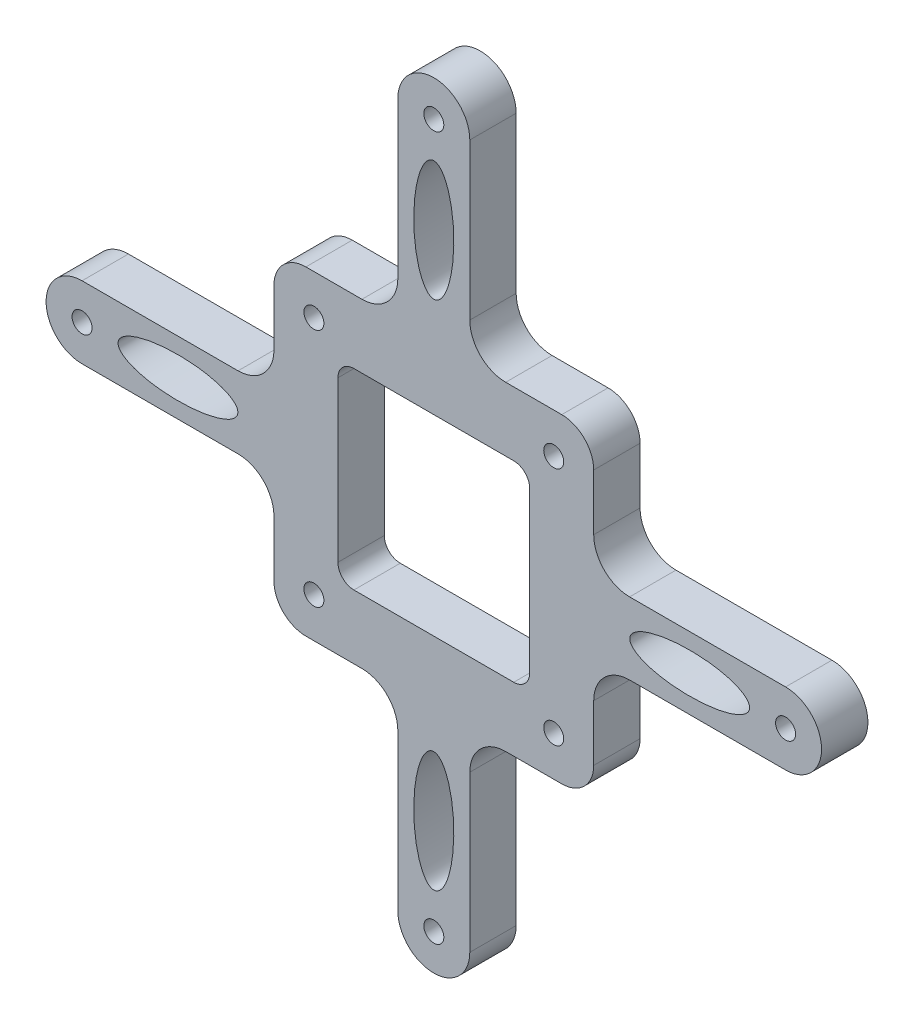
from build123d import *

# Parameters (mm, degrees)
SKETCH1_R           = 1.25
SKETCH1_RX          = 7.495001668
SKETCH1_RY          = 2.505000234
BOSS_EXTRUDE1_DEPTH = 5.8


with BuildPart() as part:
    # Sketch1 → Boss-Extrude1 (new body)
    with BuildSketch(Plane.XY):
        with BuildLine():
            Line((-16, 20), (-8.99, 20))
            ThreePointArc((-8.99, 20), (-5.815090552, 21.315090552), (-4.5, 24.49))
            Line((-4.5, 24.49), (-4.5, 44))
            ThreePointArc((-4.5, 44), (-3.181980515, 47.181980515), (0, 48.5))
            ThreePointArc((0, 48.5), (3.181980515, 47.181980515), (4.5, 44))
            Line((4.5, 44), (4.5, 24.49))
            ThreePointArc((4.5, 24.49), (5.815090552, 21.315090552), (8.99, 20))
            Line((8.99, 20), (16, 20))
            ThreePointArc((16, 20), (18.828427125, 18.828427125), (20, 16))
            Line((20, 16), (20, 8.99))
            ThreePointArc((20, 8.99), (21.315090552, 5.815090552), (24.49, 4.5))
            Line((24.49, 4.5), (44, 4.5))
            ThreePointArc((44, 4.5), (47.181980515, 3.181980515), (48.5, 0))
            ThreePointArc((48.5, 0), (47.181980515, -3.181980515), (44, -4.5))
            Line((44, -4.5), (24.49, -4.5))
            ThreePointArc((24.49, -4.5), (21.315090552, -5.815090552), (20, -8.99))
            Line((20, -8.99), (20, -16))
            ThreePointArc((20, -16), (18.828427125, -18.828427125), (16, -20))
            Line((16, -20), (8.99, -20))
            ThreePointArc((8.99, -20), (5.815090552, -21.315090552), (4.5, -24.49))
            Line((4.5, -24.49), (4.5, -44))
            ThreePointArc((4.5, -44), (3.181980515, -47.181980515), (0, -48.5))
            ThreePointArc((0, -48.5), (-3.181980515, -47.181980515), (-4.5, -44))
            Line((-4.5, -44), (-4.5, -24.49))
            ThreePointArc((-4.5, -24.49), (-5.815090552, -21.315090552), (-8.99, -20))
            Line((-8.99, -20), (-16, -20))
            ThreePointArc((-16, -20), (-18.828427125, -18.828427125), (-20, -16))
            Line((-20, -16), (-20, -8.99))
            ThreePointArc((-20, -8.99), (-21.315090552, -5.815090552), (-24.49, -4.5))
            Line((-24.49, -4.5), (-44, -4.5))
            ThreePointArc((-44, -4.5), (-47.181980515, -3.181980515), (-48.5, 0))
            ThreePointArc((-48.5, 0), (-47.181980515, 3.181980515), (-44, 4.5))
            Line((-44, 4.5), (-24.49, 4.5))
            ThreePointArc((-24.49, 4.5), (-21.315090552, 5.815090552), (-20, 8.99))
            Line((-20, 8.99), (-20, 16))
            ThreePointArc((-20, 16), (-18.828427125, 18.828427125), (-16, 20))
        make_face()
        with Locations((0, 44)):
            Circle(SKETCH1_R, mode=Mode.SUBTRACT)
        with Locations((-15, 15)):
            Circle(SKETCH1_R, mode=Mode.SUBTRACT)
        with Locations((15, 15)):
            Circle(SKETCH1_R, mode=Mode.SUBTRACT)
        with Locations((15, -15)):
            Circle(SKETCH1_R, mode=Mode.SUBTRACT)
        with Locations((-15, -15)):
            Circle(SKETCH1_R, mode=Mode.SUBTRACT)
        with Locations((44, 0)):
            Circle(SKETCH1_R, mode=Mode.SUBTRACT)
        with Locations((0, -44)):
            Circle(SKETCH1_R, mode=Mode.SUBTRACT)
        with Locations((-44, 0)):
            Circle(SKETCH1_R, mode=Mode.SUBTRACT)
        with Locations(Location((-0.004999676, 32.005), (0, 0, 89.961779812))):
            Ellipse(SKETCH1_RX, SKETCH1_RY, mode=Mode.SUBTRACT)
        with Locations(Location((32.005, -0.004999676), (0, 0, 0.038220188))):
            Ellipse(SKETCH1_RX, SKETCH1_RY, mode=Mode.SUBTRACT)
        with Locations(Location((-0.004999676, -32.005), (0, 0, -89.961779812))):
            Ellipse(SKETCH1_RX, SKETCH1_RY, mode=Mode.SUBTRACT)
        with Locations(Location((-32.005, -0.004999676), (0, 0, 179.961779812))):
            Ellipse(SKETCH1_RX, SKETCH1_RY, mode=Mode.SUBTRACT)
        with BuildLine():
            Line((9.99479618, -11.99479618), (-9.99479618, -11.99479618))
            ThreePointArc((-9.99479618, -11.99479618), (-11.409009742, -11.409009742), (-11.99479618, -9.99479618))
            Line((-11.99479618, -9.99479618), (-11.99479618, 9.99479618))
            ThreePointArc((-11.99479618, 9.99479618), (-11.409009742, 11.409009742), (-9.99479618, 11.99479618))
            Line((-9.99479618, 11.99479618), (9.99479618, 11.99479618))
            ThreePointArc((9.99479618, 11.99479618), (11.409009742, 11.409009742), (11.99479618, 9.99479618))
            Line((11.99479618, 9.99479618), (11.99479618, -9.99479618))
            ThreePointArc((11.99479618, -9.99479618), (11.409009742, -11.409009742), (9.99479618, -11.99479618))
        make_face(mode=Mode.SUBTRACT)
    extrude(amount=BOSS_EXTRUDE1_DEPTH)


solid = part.part
